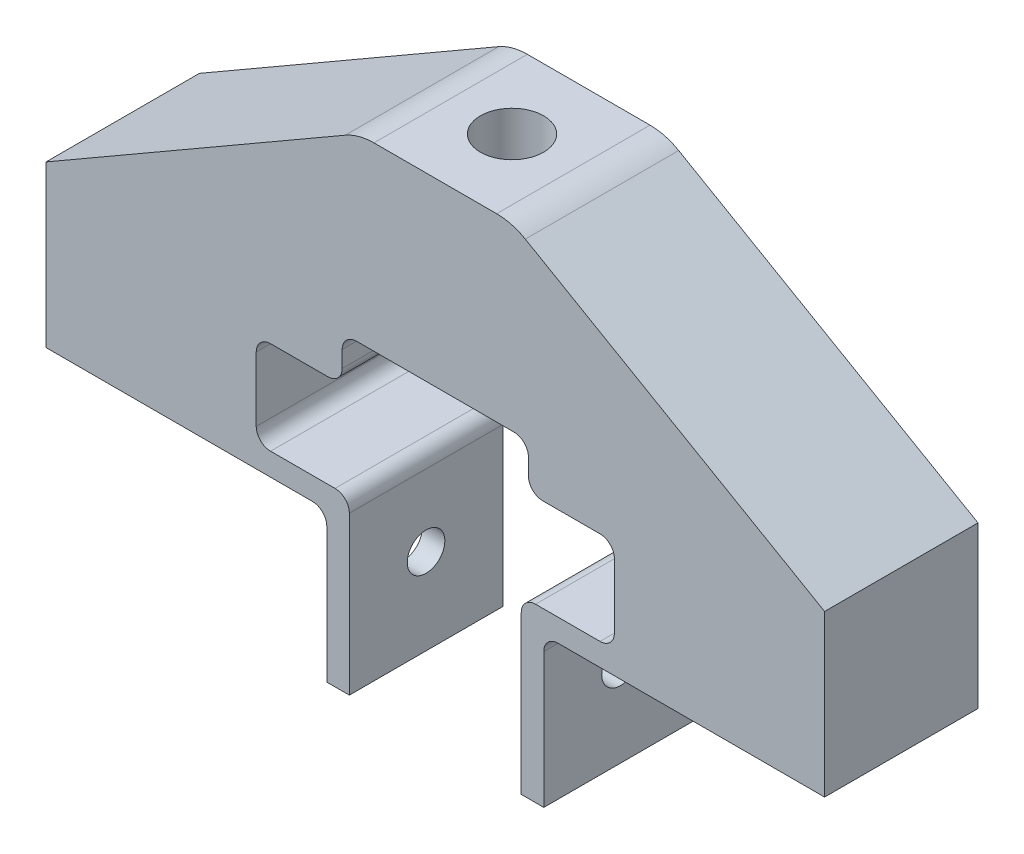
from build123d import *

# Parameters (mm, degrees)
BOSS_EXTRUDE1_DEPTH = 34
SKETCH2_R           = 7
CUT_EXTRUDE1_DEPTH  = 35
SKETCH3_R           = 4.1656
CUT_EXTRUDE2_DEPTH  = 139.022421216
FILLET1_R           = 3.175
FILLET2_R           = 12.7


with BuildPart() as part:
    # Sketch1 → Boss-Extrude1 (new body)
    with BuildSketch(Plane.XY):
        Polygon((-86.282032303, 0), (-24.05, 0), (-24.05, -33.1), (-19.05, -33.1), (-19.05, 5), (-39.6875, 5), (-39.6875, 25.6375), (-20.6375, 25.6375), (-20.6375, 35.6375), (20.6375, 35.6375), (20.6375, 25.6375), (39.6875, 25.6375), (39.6875, 5), (19.05, 5), (19.05, -33.1), (24.05, -33.1), (24.05, 0), (86.282032303, 0), (86.282032303, 35.6375), (17, 75.6375), (-17, 75.6375), (-86.282032303, 35.6375), align=None)
    extrude(amount=BOSS_EXTRUDE1_DEPTH)

    # Sketch2 → Cut-Extrude1 (cut)
    with BuildSketch(Plane(origin=(0, 75.6375, 0), x_dir=(1, 0, 0), z_dir=(0, 1, 0))):
        with Locations((0, -17)):
            Circle(SKETCH2_R)
    extrude(amount=-CUT_EXTRUDE1_DEPTH, mode=Mode.SUBTRACT)

    # Sketch3 → Cut-Extrude2 (cut, through all)
    with BuildSketch(Plane(origin=(24.05, 0, 0), x_dir=(0, 0, -1), z_dir=(1, 0, 0))):
        with Locations((-17, -14.05)):
            Circle(SKETCH3_R)
    extrude(amount=-CUT_EXTRUDE2_DEPTH, mode=Mode.SUBTRACT)

    # Fillet1
    fillet1_edges = [part.edges().sort_by_distance(p)[0] for p in [
        (-39.6875, 5, 17),
        (39.6875, 5, 17),
        (-20.6375, 35.6375, 17),
        (20.6375, 35.6375, 17),
        (39.6875, 25.6375, 17),
        (-39.6875, 25.6375, 17),
        (20.6375, 25.6375, 17),
        (-20.6375, 25.6375, 17),
        (24.05, 0, 17),
        (-24.05, 0, 17),
        (19.05, 5, 17),
        (-19.05, 5, 17),
    ]]
    fillet(fillet1_edges, radius=FILLET1_R)

    # Fillet2
    fillet2_edges = [part.edges().sort_by_distance(p)[0] for p in [
        (17, 75.6375, 17),
        (-17, 75.6375, 17),
    ]]
    fillet(fillet2_edges, radius=FILLET2_R)


solid = part.part
